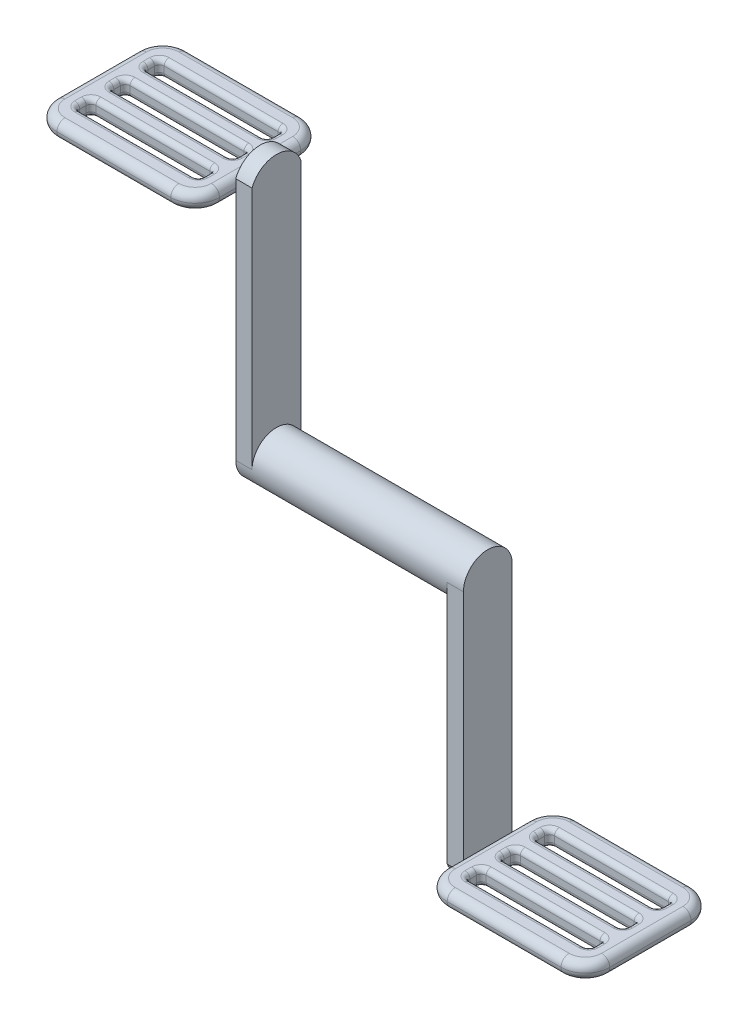
from build123d import *

# Parameters (mm, degrees)
BOSS_EXTRUDE1_DEPTH      = 70
BOSS_EXTRUDE1_DEPTH_BACK = 70
SKETCH1_R                = 15
BOSS_EXTRUDE2_DEPTH      = 10
SKETCH3_W                = 80
SKETCH3_H                = 10
BOSS_EXTRUDE3_DEPTH      = 100
BOSS_EXTRUDE4_DEPTH      = 10
SKETCH5_W                = 80
SKETCH5_H                = 10
BOSS_EXTRUDE5_DEPTH      = 100
FILLET1_R                = 15
FILLET2_R                = 5
SKETCH7_W                = 76
SKETCH7_H                = 10
CUT_EXTRUDE1_DEPTH       = 357.1855878
FILLET3_R                = 3
FILLET4_R                = 15
FILLET5_R                = 5
SKETCH8_W                = 76
SKETCH8_H                = 10
CUT_EXTRUDE2_DEPTH       = 348.504716877
FILLET6_R                = 3


with BuildPart() as part:
    # Sketch1 → Boss-Extrude1 (new, two sides: drawn at the far end of the back side and taken through both)
    with BuildSketch(Plane(origin=(0, 0, 0), x_dir=(0, 0, -1), z_dir=(1, 0, 0)).offset(-BOSS_EXTRUDE1_DEPTH_BACK)):
        Circle(SKETCH1_R)
    extrude(amount=BOSS_EXTRUDE1_DEPTH + BOSS_EXTRUDE1_DEPTH_BACK)

    # Sketch2 → Boss-Extrude2 (add)
    with BuildSketch(Plane.ZY.offset(70)):
        with BuildLine():
            Line((15, 0), (-15, 0))
            Line((-15, 0), (-15, 150))
            ThreePointArc((-15, 150), (0, 160.432235637), (15, 150))
            Line((15, 150), (15, 0))
        make_face()
    extrude(amount=-BOSS_EXTRUDE2_DEPTH)

    # Sketch4 → Boss-Extrude4 (add)
    with BuildSketch(Plane(origin=(70, 0, 0), x_dir=(0, 0, -1), z_dir=(1, 0, 0))):
        with BuildLine():
            Line((-15, 0), (15, 0))
            Line((15, 0), (15, -150))
            ThreePointArc((15, -150), (0, -160.432235637), (-15, -150))
            Line((-15, -150), (-15, 0))
        make_face()
    extrude(amount=-BOSS_EXTRUDE4_DEPTH)


with BuildPart() as body_2:
    # Sketch3 → Boss-Extrude3 (new body)
    with BuildSketch(Plane.ZY.offset(70)):
        with Locations((0, 145)):
            Rectangle(SKETCH3_W, SKETCH3_H)
    extrude(amount=BOSS_EXTRUDE3_DEPTH)

    # Fillet1
    fillet1_edges = [body_2.edges().sort_by_distance(p)[0] for p in [
        (-170, 145, 40),
        (-170, 145, -40),
        (-70, 145, 40),
        (-70, 145, -40),
    ]]
    fillet(fillet1_edges, radius=FILLET1_R)

    # Fillet2
    fillet2_edges = [body_2.edges().sort_by_distance(p)[0] for p in [
        (-70, 140, 0),
        (-70, 150, 0),
        (-74.393398282, 140, 35.606601718),
        (-120, 140, 40),
        (-165.606601718, 140, 35.606601718),
        (-170, 140, 0),
        (-165.606601718, 140, -35.606601718),
        (-120, 140, -40),
        (-74.393398282, 140, -35.606601718),
        (-120, 150, 40),
        (-170, 150, 0),
        (-120, 150, -40),
        (-74.393398282, 150, -35.606601718),
        (-165.606601718, 150, -35.606601718),
        (-165.606601718, 150, 35.606601718),
        (-74.393398282, 150, 35.606601718),
    ]]
    fillet(fillet2_edges, radius=FILLET2_R - 0.0001)  # a hair under: the kernel refuses the full size

    # Sketch7 → Cut-Extrude1 (cut, through all)
    with BuildSketch(Plane(origin=(0, 150, 0), x_dir=(1, 0, 0), z_dir=(0, 1, 0))):
        with Locations((-120, 21)):
            Rectangle(SKETCH7_W, SKETCH7_H)
        with Locations((-120, 0)):
            Rectangle(SKETCH7_W, SKETCH7_H)
        with Locations((-120, -21)):
            Rectangle(SKETCH7_W, SKETCH7_H)
    extrude(amount=-CUT_EXTRUDE1_DEPTH, mode=Mode.SUBTRACT)

    # Fillet3
    fillet3_edges = [body_2.edges().sort_by_distance(p)[0] for p in [
        (-82, 150, 0),
        (-120, 150, -5),
        (-158, 140, 21),
        (-158, 145, 26),
        (-120, 140, 16),
        (-158, 145, 16),
        (-82, 140, 21),
        (-82, 145, 16),
        (-120, 140, 26),
        (-82, 145, 26),
        (-158, 150, 21),
        (-120, 150, 26),
        (-82, 150, 21),
        (-120, 150, 16),
        (-158, 140, -21),
        (-158, 145, -16),
        (-120, 140, -26),
        (-158, 145, -26),
        (-82, 140, -21),
        (-82, 145, -26),
        (-120, 140, -16),
        (-82, 145, -16),
        (-158, 150, -21),
        (-120, 150, -16),
        (-82, 150, -21),
        (-120, 150, -26),
        (-158, 140, 0),
        (-158, 145, 5),
        (-120, 140, -5),
        (-158, 145, -5),
        (-82, 140, 0),
        (-82, 145, -5),
        (-120, 140, 5),
        (-82, 145, 5),
        (-158, 150, 0),
        (-120, 150, 5),
    ]]
    fillet(fillet3_edges, radius=FILLET3_R)


with BuildPart() as body_3:
    # Sketch5 → Boss-Extrude5 (new body)
    with BuildSketch(Plane(origin=(70, 0, 0), x_dir=(0, 0, -1), z_dir=(1, 0, 0))):
        with Locations((0, -145)):
            Rectangle(SKETCH5_W, SKETCH5_H)
    extrude(amount=BOSS_EXTRUDE5_DEPTH)

    # Fillet4
    fillet4_edges = [body_3.edges().sort_by_distance(p)[0] for p in [
        (170, -145, 40),
        (170, -145, -40),
        (70, -145, 40),
        (70, -145, -40),
    ]]
    fillet(fillet4_edges, radius=FILLET4_R)

    # Fillet5
    fillet5_edges = [body_3.edges().sort_by_distance(p)[0] for p in [
        (165.606601718, -140, -35.606601718),
        (120, -140, -40),
        (74.393398282, -140, -35.606601718),
        (70, -140, 0),
        (74.393398282, -140, 35.606601718),
        (120, -140, 40),
        (165.606601718, -140, 35.606601718),
        (74.393398282, -150, 35.606601718),
        (120, -150, 40),
        (165.606601718, -150, 35.606601718),
        (170, -150, 0),
        (165.606601718, -150, -35.606601718),
        (120, -150, -40),
        (74.393398282, -150, -35.606601718),
        (70, -150, 0),
        (170, -140, 0),
    ]]
    fillet(fillet5_edges, radius=FILLET5_R - 0.0001)  # a hair under: the kernel refuses the full size

    # Sketch8 → Cut-Extrude2 (cut, through all)
    with BuildSketch(Plane(origin=(0, -140, 0), x_dir=(1, 0, 0), z_dir=(0, 1, 0))):
        with Locations((120, 0)):
            Rectangle(SKETCH8_W, SKETCH8_H)
        with Locations((120, 21)):
            Rectangle(SKETCH8_W, SKETCH8_H)
        with Locations((120, -21)):
            Rectangle(SKETCH8_W, SKETCH8_H)
    extrude(amount=-CUT_EXTRUDE2_DEPTH, mode=Mode.SUBTRACT)

    # Fillet6
    fillet6_edges = [body_3.edges().sort_by_distance(p)[0] for p in [
        (82, -140, -21),
        (120, -140, -16),
        (158, -140, -21),
        (120, -140, -26),
        (82, -145, 5),
        (82, -145, -5),
        (158, -145, -5),
        (158, -145, 5),
        (82, -140, 0),
        (120, -140, 5),
        (158, -140, 0),
        (120, -140, -5),
        (120, -150, 5),
        (158, -150, 0),
        (120, -150, -5),
        (82, -150, 0),
        (120, -150, -16),
        (158, -150, -21),
        (120, -150, -26),
        (82, -150, -21),
        (120, -150, 26),
        (158, -150, 21),
        (120, -150, 16),
        (82, -150, 21),
        (82, -145, 26),
        (82, -145, 16),
        (158, -145, 16),
        (158, -145, 26),
        (82, -140, 21),
        (120, -140, 26),
        (158, -140, 21),
        (120, -140, 16),
        (82, -145, -16),
        (82, -145, -26),
        (158, -145, -26),
        (158, -145, -16),
    ]]
    fillet(fillet6_edges, radius=FILLET6_R)


solid = Compound([part.part, body_2.part, body_3.part])
